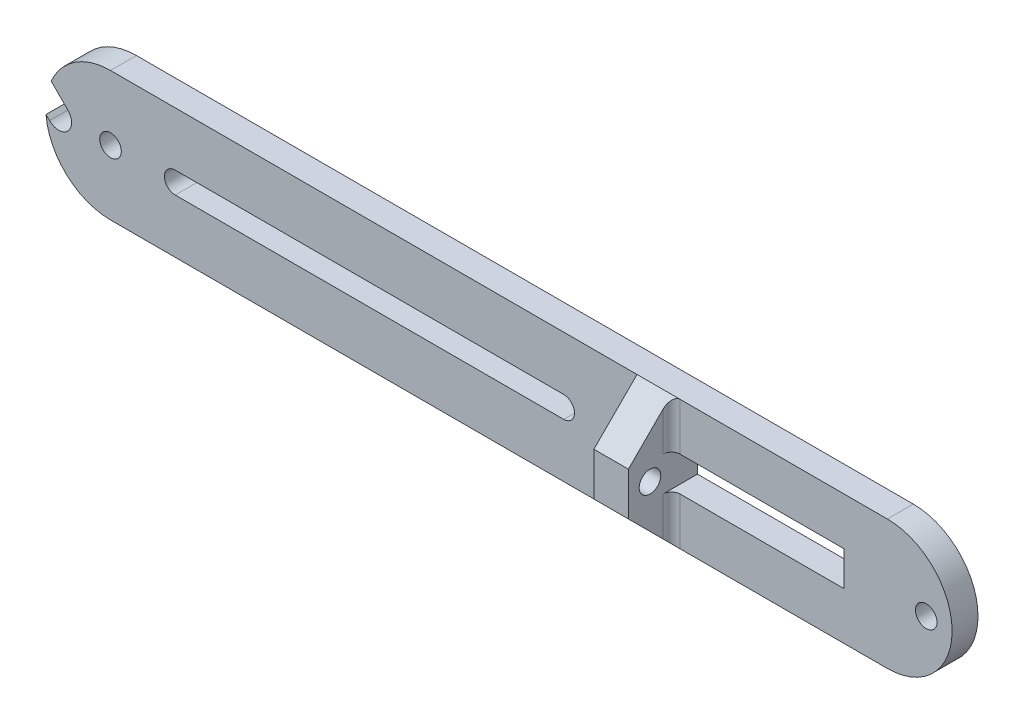
from build123d import *

# Parameters (mm, degrees)
ESQUISSE1_R             = 2.5
ESQUISSE1_W             = 40
ESQUISSE1_H             = 8
BOSS_EXTRU_1_DEPTH      = 6
ESQUISSE2_R             = 2.5
BOSS_EXTRU_2_DEPTH      = 8
CONG_2_R                = 2
ENL_V_MAT_EXTRU_1_DEPTH = 4
ENL_V_START             = -10
ENL_V_MAT_EXTRU_4_DEPTH = 10


with BuildPart() as part:
    # Esquisse1 → Boss.-Extru.1 (new body)
    with BuildSketch(Plane.XY):
        with BuildLine():
            Line((90, -15), (-90, -15))
            ThreePointArc((-90, -15), (-105, 0), (-90, 15))
            Line((-90, 15), (90, 15))
            ThreePointArc((90, 15), (105, 0), (90, -15))
        make_face()
        with Locations((99, 0)):
            Circle(ESQUISSE1_R, mode=Mode.SUBTRACT)
        with Locations((-90, 0)):
            Circle(ESQUISSE1_R, mode=Mode.SUBTRACT)
        with BuildLine():
            Line((0, -2.5), (-75, -2.5))
            ThreePointArc((-75, -2.5), (-77.5, 0), (-75, 2.5))
            Line((-75, 2.5), (0, 2.5))
            Line((0, 2.5), (15, 2.5))
            ThreePointArc((15, 2.5), (17.5, 0), (15, -2.5))
            Line((15, -2.5), (0, -2.5))
        make_face(mode=Mode.SUBTRACT)
        with Locations((60, 0)):
            Rectangle(ESQUISSE1_W, ESQUISSE1_H, mode=Mode.SUBTRACT)
    extrude(amount=BOSS_EXTRU_1_DEPTH)

    # Esquisse2 → Boss.-Extru.2 (add)
    with BuildSketch(Plane(origin=(40, 0, 0), x_dir=(0, 0, -1), z_dir=(1, 0, 0))):
        Polygon((-16, 5), (-16, -5), (-6, -15), (-6, -5), (-6, 5), (-6, 15), align=None)
        with Locations((-11, 0)):
            Circle(ESQUISSE2_R, mode=Mode.SUBTRACT)
    extrude(amount=-BOSS_EXTRU_2_DEPTH)

    # Congé2
    cong_2_edges = [part.edges().sort_by_distance(p)[0] for p in [
        (40, 9.5, 6),
        (40, -9.5, 6),
    ]]
    fillet(cong_2_edges, radius=CONG_2_R)

    # Esquisse3 → Enlèv. mat.-Extru.1 (cut)
    with BuildSketch(Plane.ZY.offset(-32)):
        Polygon((11, 4), (14.464101615, 2), (14.464101615, -2), (11, -4), (7.535898385, -2), (7.535898385, 2), align=None)
    extrude(amount=-ENL_V_MAT_EXTRU_1_DEPTH, mode=Mode.SUBTRACT)

    # Esquisse4 → Enlèv. mat.-Extru.4 (cut)
    with BuildSketch(Plane.XY.offset(6).offset(ENL_V_START)):
        with BuildLine():
            Line((-104.94364809, -1.298992597), (-104.121320344, -2.121320344))
            ThreePointArc((-104.121320344, -2.121320344), (-99.878679656, -2.121320344), (-99.878679656, 2.121320344))
            Line((-99.878679656, 2.121320344), (-103.750652313, 5.993293))
            ThreePointArc((-103.750652313, 5.993293), (-104.803211685, 2.421760475), (-104.94364809, -1.298992597))
        make_face()
    extrude(amount=ENL_V_MAT_EXTRU_4_DEPTH, mode=Mode.SUBTRACT)


solid = part.part
